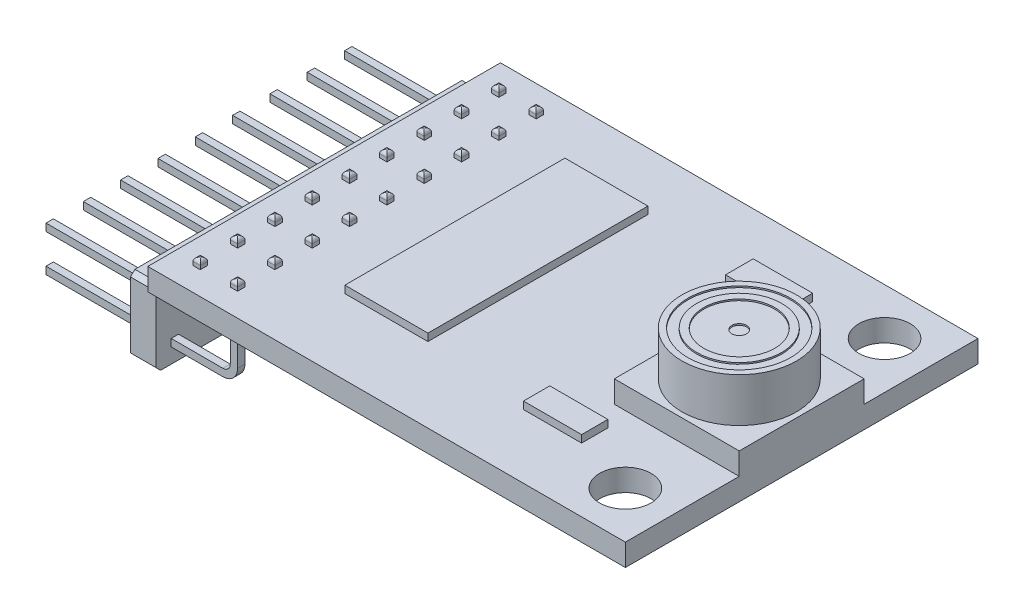
from build123d import *

# Parameters (mm, degrees)
SKETCH_1_W            = 32.5
SKETCH_1_H            = 24
SKETCH_1_R            = 1.75
EXTRUDE_1_DEPTH       = 1.5
SKETCH_2_W            = 8.5
SKETCH_2_H            = 8.5
EXTRUDE_2_DEPTH       = 1.5
SKETCH_3_R            = 3.9
EXTRUDE_3_DEPTH       = 3
EXTRUDE_4_DEPTH       = 1.5
EXTRUDE_4_DEPTH_BACK  = 2
SKETCH_4_W            = 0.5
SKETCH_4_H            = 0.5
EXTRUDE_5_DEPTH       = 4.04
EXTRUDE_5_DEPTH_BACK  = 2
SKETCH_4_3_W          = 0.5
SKETCH_4_3_H          = 0.5
FILLET_1_R            = 0.25
SKETCH_5_W            = 5.650856844
SKETCH_5_H            = 14.974770637
SKETCH_5_W_2          = 4.049780739
SKETCH_5_H_2          = 1.883618948
SKETCH_5_W_3          = 3.955599791
SKETCH_5_H_3          = 1.789438001
EXTRUDE_6_DEPTH       = 0.5
SKETCH_6_W            = 1.635085892
SKETCH_6_H            = 0.931090578
SKETCH_6_W_2          = 1.385281103
SKETCH_6_H_2          = 0.772123894
SKETCH_6_W_3          = 2.066566892
SKETCH_6_H_3          = 0.908381051
SKETCH_6_W_4          = 1.816762103
SKETCH_6_H_4          = 1.294442998
SKETCH_6_H_5          = 1.22631442
SKETCH_6_W_5          = 3.497267048
SKETCH_6_H_6          = 4.723581467
SKETCH_6_W_6          = 1.612376366
SKETCH_6_H_7          = 1.896245445
SKETCH_6_W_7          = 0.817542946
SKETCH_6_H_8          = 1.95301926
SKETCH_6_W_8          = 1.657795418
SKETCH_6_H_9          = 1.612376366
SKETCH_6_W_9          = 1.680504945
SKETCH_6_H_10         = 2.384500259
SKETCH_6_W_10         = 1.430700156
SKETCH_6_H_11         = 2.407209786
SKETCH_6_W_11         = 1.748633524
SKETCH_6_W_12         = 1.930309734
SKETCH_6_H_12         = 3.043076522
SKETCH_6_W_13         = 0.97650963
SKETCH_6_H_13         = 1.907600207
SKETCH_6_W_14         = 1.442054919
SKETCH_6_W_15         = 1.566957314
SKETCH_6_W_16         = 1.794052576
SKETCH_6_W_17         = 1.135476314
SKETCH_6_H_14         = 1.407990629
SKETCH_6_W_18         = 1.208438361
SKETCH_6_W_19         = 0.783478657
SKETCH_6_H_15         = 1.907600208
SKETCH_6_W_20         = 0.999219156
SKETCH_6_H_16         = 1.680504945
SKETCH_6_H_17         = 1.453409682
SKETCH_6_W_21         = 2.009793076
SKETCH_6_W_22         = 3.020366996
SKETCH_6_H_18         = 0.726704841
EXTRUDE_7_DEPTH       = 1
SKETCH_8_W            = 0.5
SKETCH_8_H            = 0.5
EXTRUDE_8_DEPTH       = 12.54
SKETCH_9_W            = 0.5
SKETCH_9_H            = 0.5
EXTRUDE_9_DEPTH       = 10
FILLET_3_R            = 0.5
FILLET_4_R            = 1
EXTRUDE_10_DEPTH      = 1.02
EXTRUDE_10_DEPTH_BACK = 4.06
SKETCH_10_W           = 1.75
SKETCH_10_H           = 22.86
CHAMFER_1_SIZE        = 0.3
SKETCH_11_R           = 3.5
CUT_EXTRUDE_1_DEPTH   = 0.1
SKETCH_12_R           = 0.5
CUT_EXTRUDE_2_DEPTH   = 0.1
SKETCH_13_R           = 2.892534236
SKETCH_13_R_2         = 2.410654774
EXTRUDE_11_DEPTH      = 0.1


# Some blends are built 0.0001 mm under size
with BuildPart() as part:
    # 草图1 → 凸台-拉伸1 (new body)
    with BuildSketch(Plane(origin=(0, 0, 0), x_dir=(1, 0, 0), z_dir=(0, 1, 0))):
        with Locations((16.25, -12)):
            Rectangle(SKETCH_1_W, SKETCH_1_H)
        with Locations(Location((29.32, -3.18, 0), (0, 0, 270))):
            Circle(SKETCH_1_R, mode=Mode.SUBTRACT)
        with Locations(Location((29.32, -20.82, 0), (0, 0, 270))):
            Circle(SKETCH_1_R, mode=Mode.SUBTRACT)
    extrude(amount=EXTRUDE_1_DEPTH)

    # 草图2 → 凸台-拉伸2 (add)
    with BuildSketch(Plane(origin=(0, 1.5, 0), x_dir=(1, 0, 0), z_dir=(0, 1, 0))):
        with Locations((28.25, -12)):
            Rectangle(SKETCH_2_W, SKETCH_2_H)
    extrude(amount=EXTRUDE_2_DEPTH)

    # 草图3 → 凸台-拉伸3 (add)
    with BuildSketch(Plane(origin=(0, 3, 0), x_dir=(1, 0, 0), z_dir=(0, 1, 0))):
        with Locations(Location((28.25, -12, 0), (0, 0, 270))):
            Circle(SKETCH_3_R)
    extrude(amount=EXTRUDE_3_DEPTH)

    # 草图4 → 凸台-拉伸4 (add, two sides: drawn at the far end of the back side and taken through both)
    with BuildSketch(Plane.XZ.offset(-EXTRUDE_4_DEPTH_BACK)):
        with Locations((1.73, 22.16)):
            Rectangle(SKETCH_4_W, SKETCH_4_H)
        with Locations((1.73, 19.62)):
            Rectangle(SKETCH_4_W, SKETCH_4_H)
        with Locations((1.73, 17.08)):
            Rectangle(SKETCH_4_W, SKETCH_4_H)
        with Locations((1.73, 14.54)):
            Rectangle(SKETCH_4_W, SKETCH_4_H)
        with Locations((1.73, 12)):
            Rectangle(SKETCH_4_W, SKETCH_4_H)
        with Locations((1.73, 12)):
            Rectangle(SKETCH_4_W, SKETCH_4_H)
        with Locations((1.73, 9.46)):
            Rectangle(SKETCH_4_W, SKETCH_4_H)
        with Locations((1.73, 6.92)):
            Rectangle(SKETCH_4_W, SKETCH_4_H)
        with Locations((1.73, 4.38)):
            Rectangle(SKETCH_4_W, SKETCH_4_H)
        with Locations((1.73, 1.84)):
            Rectangle(SKETCH_4_W, SKETCH_4_H)
    extrude(amount=EXTRUDE_4_DEPTH + EXTRUDE_4_DEPTH_BACK)

    # 草图4<3> → 凸台-拉伸5 (add, two sides: drawn at the far end of the back side and taken through both)
    with BuildSketch(Plane.XZ.offset(-EXTRUDE_5_DEPTH_BACK)):
        with Locations((4.27, 22.16)):
            Rectangle(SKETCH_4_3_W, SKETCH_4_3_H)
        with Locations((4.27, 19.62)):
            Rectangle(SKETCH_4_3_W, SKETCH_4_3_H)
        with Locations((4.27, 17.08)):
            Rectangle(SKETCH_4_3_W, SKETCH_4_3_H)
        with Locations((4.27, 14.54)):
            Rectangle(SKETCH_4_3_W, SKETCH_4_3_H)
        with Locations((4.27, 12)):
            Rectangle(SKETCH_4_3_W, SKETCH_4_3_H)
        with Locations((4.27, 12)):
            Rectangle(SKETCH_4_3_W, SKETCH_4_3_H)
        with Locations((4.27, 9.46)):
            Rectangle(SKETCH_4_3_W, SKETCH_4_3_H)
        with Locations((4.27, 6.92)):
            Rectangle(SKETCH_4_3_W, SKETCH_4_3_H)
        with Locations((4.27, 4.38)):
            Rectangle(SKETCH_4_3_W, SKETCH_4_3_H)
        with Locations((4.27, 1.84)):
            Rectangle(SKETCH_4_3_W, SKETCH_4_3_H)
    extrude(amount=EXTRUDE_5_DEPTH + EXTRUDE_5_DEPTH_BACK)

    # 圆角1
    fillet_1_edges = [part.edges().sort_by_distance(p)[0] for p in [
        (1.48, 2, 14.54),
        (1.73, 2, 14.29),
        (1.73, 2, 14.79),
        (1.98, 2, 14.54),
        (1.73, 2, 11.75),
        (1.48, 2, 12),
        (1.98, 2, 12),
        (1.73, 2, 12.25),
        (1.48, 2, 9.46),
        (1.73, 2, 9.21),
        (1.73, 2, 9.71),
        (1.98, 2, 9.46),
        (1.48, 2, 6.92),
        (1.73, 2, 6.67),
        (1.73, 2, 7.17),
        (1.98, 2, 6.92),
        (1.48, 2, 4.38),
        (1.73, 2, 4.13),
        (1.73, 2, 4.63),
        (1.98, 2, 4.38),
        (1.48, 2, 1.84),
        (1.73, 2, 1.59),
        (1.73, 2, 2.09),
        (1.98, 2, 1.84),
        (4.27, 2, 21.91),
        (4.02, 2, 22.16),
        (4.27, 2, 22.41),
        (4.52, 2, 22.16),
        (4.27, 2, 19.37),
        (4.02, 2, 19.62),
        (4.27, 2, 19.87),
        (4.52, 2, 19.62),
        (4.27, 2, 16.83),
        (4.02, 2, 17.08),
        (4.27, 2, 17.33),
        (4.52, 2, 17.08),
        (4.27, 2, 14.29),
        (4.02, 2, 14.54),
        (4.27, 2, 14.79),
        (4.52, 2, 14.54),
        (4.27, 2, 11.75),
        (4.02, 2, 12),
        (4.52, 2, 12),
        (4.27, 2, 12.25),
        (4.27, 2, 9.21),
        (4.02, 2, 9.46),
        (4.27, 2, 9.71),
        (4.52, 2, 9.46),
        (4.27, 2, 6.67),
        (4.02, 2, 6.92),
        (4.27, 2, 7.17),
        (4.52, 2, 6.92),
        (4.27, 2, 4.13),
        (4.02, 2, 4.38),
        (4.27, 2, 4.63),
        (4.52, 2, 4.38),
        (4.27, 2, 1.59),
        (4.02, 2, 1.84),
        (4.27, 2, 2.09),
        (4.52, 2, 1.84),
        (1.48, 2, 22.16),
        (1.73, 2, 21.91),
        (1.73, 2, 22.41),
        (1.98, 2, 22.16),
        (1.48, 2, 19.62),
        (1.73, 2, 19.37),
        (1.73, 2, 19.87),
        (1.98, 2, 19.62),
        (1.48, 2, 17.08),
        (1.73, 2, 16.83),
        (1.73, 2, 17.33),
        (1.98, 2, 17.08),
    ]]
    fillet(fillet_1_edges, radius=FILLET_1_R - 0.0001)  # a hair under: the kernel refuses the full size

    # 草图5 → 凸台-拉伸6 (add)
    with BuildSketch(Plane(origin=(0, 1.5, 0), x_dir=(1, 0, 0), z_dir=(0, 1, 0))):
        with Locations((11.135974556, -11.411369078)):
            Rectangle(SKETCH_5_W, SKETCH_5_H)
        with Locations((22.677849661, -4.394888497)):
            Rectangle(SKETCH_5_W_2, SKETCH_5_H_2)
        with Locations((23.195844872, -18.757482977)):
            Rectangle(SKETCH_5_W_3, SKETCH_5_H_3)
    extrude(amount=EXTRUDE_6_DEPTH)

    # 草图6 → 凸台-拉伸7 (add)
    with BuildSketch(Plane.XZ):
        with Locations((11.287968507, 20.243558041)):
            Rectangle(SKETCH_6_W, SKETCH_6_H)
        with Locations((11.412870901, 17.734155387)):
            Rectangle(SKETCH_6_W_2, SKETCH_6_H_2)
        with Locations((11.503709007, 15.622169443)):
            Rectangle(SKETCH_6_W_3, SKETCH_6_H_3)
        with Locations((11.628611402, 13.703214471)):
            Rectangle(SKETCH_6_W_4, SKETCH_6_H_4)
        with Locations((11.503709007, 11.511745185)):
            Rectangle(SKETCH_6_W_3, SKETCH_6_H_5)
        with Locations((17.941859708, 13.714569235)):
            Rectangle(SKETCH_6_W_5, SKETCH_6_H_6)
        with Locations((16.749609578, 19.295435319)):
            Rectangle(SKETCH_6_W_6, SKETCH_6_H_7)
        with Locations((8.880758721, 8.264282926)):
            Rectangle(SKETCH_6_W_7, SKETCH_6_H_8)
        with Locations((11.049518481, 8.093961479)):
            Rectangle(SKETCH_6_W_8, SKETCH_6_H_9)
        with Locations((13.89956403, 8.048542427)):
            Rectangle(SKETCH_6_W_9, SKETCH_6_H_10)
        with Locations((16.272709526, 8.309701979)):
            Rectangle(SKETCH_6_W_10, SKETCH_6_H_11)
        with Locations((18.81617647, 8.048542427)):
            Rectangle(SKETCH_6_W_11, SKETCH_6_H_10)
        with Locations((21.677576782, 7.991768611)):
            Rectangle(SKETCH_6_W_12, SKETCH_6_H_12)
        with Locations((24.59575091, 8.048542427)):
            Rectangle(SKETCH_6_W_4, SKETCH_6_H_10)
        with Locations((8.960242063, 4.767015879)):
            Rectangle(SKETCH_6_W_13, SKETCH_6_H_13)
        with Locations((10.782681548, 4.767015879)):
            Rectangle(SKETCH_6_W_14, SKETCH_6_H_13)
        with Locations((12.661894847, 4.767015879)):
            Rectangle(SKETCH_6_W_15, SKETCH_6_H_13)
        with Locations((15.046395107, 4.767015879)):
            Rectangle(SKETCH_6_W_16, SKETCH_6_H_13)
        with Locations((16.988059604, 4.857853984)):
            Rectangle(SKETCH_6_W_17, SKETCH_6_H_14)
        with Locations((9.094082486, 1.905615567)):
            Rectangle(SKETCH_6_W_18, SKETCH_6_H_3)
        with Locations((12.270155519, 2.405225145)):
            Rectangle(SKETCH_6_W_19, SKETCH_6_H_15)
        with Locations((14.240206924, 2.291677514)):
            Rectangle(SKETCH_6_W_20, SKETCH_6_H_16)
        with Locations((17.067542946, 2.405225145)):
            Rectangle(SKETCH_6_W_11, SKETCH_6_H_17)
        with Locations((22.68247332, 4.619403958)):
            Rectangle(SKETCH_6_W_21, SKETCH_6_H)
        with Locations((22.472410202, 2.041872725)):
            Rectangle(SKETCH_6_W_22, SKETCH_6_H_18)
    extrude(amount=EXTRUDE_7_DEPTH)

    # 草图8 → 凸台-拉伸8 (add)
    with BuildSketch(Plane.ZY.offset(-4.02)):
        with Locations((22.16, -3.79)):
            Rectangle(SKETCH_8_W, SKETCH_8_H)
        with Locations((19.62, -3.79)):
            Rectangle(SKETCH_8_W, SKETCH_8_H)
        with Locations((17.08, -3.79)):
            Rectangle(SKETCH_8_W, SKETCH_8_H)
        with Locations((14.54, -3.79)):
            Rectangle(SKETCH_8_W, SKETCH_8_H)
        with Locations((12, -3.79)):
            Rectangle(SKETCH_8_W, SKETCH_8_H)
        with Locations((9.46, -3.79)):
            Rectangle(SKETCH_8_W, SKETCH_8_H)
        with Locations((6.92, -3.79)):
            Rectangle(SKETCH_8_W, SKETCH_8_H)
        with Locations((4.38, -3.79)):
            Rectangle(SKETCH_8_W, SKETCH_8_H)
        with Locations((1.84, -3.79)):
            Rectangle(SKETCH_8_W, SKETCH_8_H)
    extrude(amount=EXTRUDE_8_DEPTH)

    # 草图9 → 凸台-拉伸9 (add)
    with BuildSketch(Plane.ZY.offset(-1.48)):
        with Locations((1.84, -1.25)):
            Rectangle(SKETCH_9_W, SKETCH_9_H)
        with Locations((4.38, -1.25)):
            Rectangle(SKETCH_9_W, SKETCH_9_H)
        with Locations((6.92, -1.25)):
            Rectangle(SKETCH_9_W, SKETCH_9_H)
        with Locations((9.46, -1.25)):
            Rectangle(SKETCH_9_W, SKETCH_9_H)
        with Locations((12, -1.25)):
            Rectangle(SKETCH_9_W, SKETCH_9_H)
        with Locations((14.54, -1.25)):
            Rectangle(SKETCH_9_W, SKETCH_9_H)
        with Locations((17.08, -1.25)):
            Rectangle(SKETCH_9_W, SKETCH_9_H)
        with Locations((19.62, -1.25)):
            Rectangle(SKETCH_9_W, SKETCH_9_H)
        with Locations((22.16, -1.25)):
            Rectangle(SKETCH_9_W, SKETCH_9_H)
    extrude(amount=EXTRUDE_9_DEPTH)

    # 圆角3
    fillet_3_edges = [part.edges().sort_by_distance(p)[0] for p in [
        (4.02, -3.54, 22.16),
        (4.02, -3.54, 19.62),
        (4.02, -3.54, 17.08),
        (4.02, -3.54, 14.54),
        (4.02, -3.54, 12),
        (4.02, -3.54, 9.46),
        (4.02, -3.54, 6.92),
        (4.02, -3.54, 4.38),
        (4.02, -3.54, 1.84),
        (1.48, -1, 1.84),
        (1.48, -1, 4.38),
        (1.48, -1, 6.92),
        (1.48, -1, 9.46),
        (1.48, -1, 12),
        (1.48, -1, 14.54),
        (1.48, -1, 17.08),
        (1.48, -1, 19.62),
        (1.48, -1, 22.16),
    ]]
    fillet(fillet_3_edges, radius=FILLET_3_R)

    # 圆角4
    fillet_4_edges = [part.edges().sort_by_distance(p)[0] for p in [
        (1.98, -1.5, 14.54),
        (1.98, -1.5, 12),
        (1.98, -1.5, 9.46),
        (1.98, -1.5, 6.92),
        (1.98, -1.5, 4.38),
        (1.98, -1.5, 1.84),
        (4.52, -4.04, 22.16),
        (4.52, -4.04, 19.62),
        (4.52, -4.04, 17.08),
        (4.52, -4.04, 14.54),
        (4.52, -4.04, 12),
        (4.52, -4.04, 9.46),
        (4.52, -4.04, 6.92),
        (4.52, -4.04, 4.38),
        (4.52, -4.04, 1.84),
        (1.98, -1.5, 22.16),
        (1.98, -1.5, 19.62),
        (1.98, -1.5, 17.08),
    ]]
    fillet(fillet_4_edges, radius=FILLET_4_R)

    # 草图10 → 凸台-拉伸10 (add, two sides: drawn at the far end of the back side and taken through both)
    with BuildSketch(Plane(origin=(0, -1, 0), x_dir=(1, 0, 0), z_dir=(0, 1, 0)).offset(-EXTRUDE_10_DEPTH_BACK)):
        with Locations((-0.875, -12)):
            Rectangle(SKETCH_10_W, SKETCH_10_H)
    extrude(amount=EXTRUDE_10_DEPTH + EXTRUDE_10_DEPTH_BACK)

    # 倒角1
    # the kernel refuses this chamfer: 0.3 mm, written as the material it takes off along each edge
    with BuildSketch(Plane(origin=(-2.521504896, -5.06, 0.57), x_dir=(0, 0.9996219169112968, -0.027495876610586265), z_dir=(1, 0, 0)), Plane(origin=(0.771504896, -5.06, 23.43), x_dir=(0, 0.9996219169112968, 0.027495876610584464), z_dir=(-1, 0, 0))) as chamfer_1_piece_1:
        Polygon((CHAMFER_1_SIZE * 0.999621916911, CHAMFER_1_SIZE * 0.0274958766106), (-CHAMFER_1_SIZE * 0.0274958766106, CHAMFER_1_SIZE * 0.999621916911), (0, 0), align=None)
    extrude(amount=3.293009793, mode=Mode.SUBTRACT)
    with BuildSketch(Plane(origin=(0, 0.02, 23.43), x_dir=(0, 0.02749587661058633, -0.9996219169112968), z_dir=(-1, 0, 0)), Plane(origin=(-2.521504896, 0.02, 0.57), x_dir=(0, 0.027495876610586327, 0.9996219169112968), z_dir=(1, 0, 0))) as chamfer_1_piece_2:
        Polygon((CHAMFER_1_SIZE * 0.999621916911, CHAMFER_1_SIZE * 0.0274958766106), (-CHAMFER_1_SIZE * 0.0274958766106, CHAMFER_1_SIZE * 0.999621916911), (0, 0), align=None)
    extrude(amount=2.521504896, mode=Mode.SUBTRACT)

    # 草图11 → 切除-拉伸1 (cut)
    with BuildSketch(Plane(origin=(0, 6, 0), x_dir=(1, 0, 0), z_dir=(0, 1, 0))):
        with Locations(Location((28.25, -12, 0), (0, 0, 270))):
            Circle(SKETCH_11_R)
    extrude(amount=-CUT_EXTRUDE_1_DEPTH, mode=Mode.SUBTRACT)

    # 草图12 → 切除-拉伸2 (cut)
    with BuildSketch(Plane(origin=(0, 5.9, 0), x_dir=(1, 0, 0), z_dir=(0, 1, 0))):
        with Locations(Location((28.25, -12, 0), (0, 0, 270))):
            Circle(SKETCH_12_R)
    extrude(amount=-CUT_EXTRUDE_2_DEPTH, mode=Mode.SUBTRACT)

    # 草图13 → 凸台-拉伸11 (add)
    with BuildSketch(Plane(origin=(0, 5.9, 0), x_dir=(1, 0, 0), z_dir=(0, 1, 0))):
        with Locations(Location((28.25, -12, 0), (0, 0, 270))):
            Circle(SKETCH_13_R)
        with Locations(Location((28.25, -12, 0), (0, 0, 270))):
            Circle(SKETCH_13_R_2, mode=Mode.SUBTRACT)
    extrude(amount=EXTRUDE_11_DEPTH)


solid = part.part
